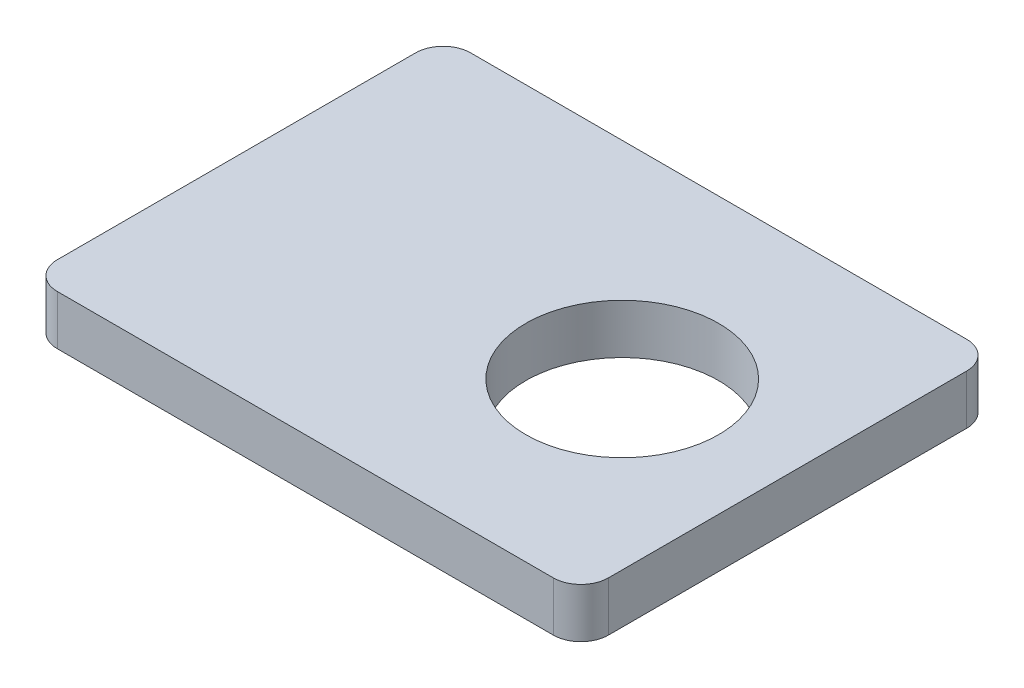
from build123d import *

# Parameters (mm, degrees)
SKETCH_1_W      = 200
SKETCH_1_H      = 150
SKETCH_1_R      = 35
EXTRUDE_1_DEPTH = 18
FILLET_1_R      = 10


with BuildPart() as part:
    # 草图1 → 凸台-拉伸1 (new body)
    with BuildSketch(Plane(origin=(0, 0, 0), x_dir=(1, 0, 0), z_dir=(0, 1, 0))):
        Rectangle(SKETCH_1_W, SKETCH_1_H)
        with Locations((40, 0)):
            Circle(SKETCH_1_R, mode=Mode.SUBTRACT)
    extrude(amount=EXTRUDE_1_DEPTH)

    # 圆角1
    fillet_1_edges = [part.edges().sort_by_distance(p)[0] for p in [
        (-100, 9, -75),
        (100, 9, -75),
        (100, 9, 75),
        (-100, 9, 75),
    ]]
    fillet(fillet_1_edges, radius=FILLET_1_R)


solid = part.part
